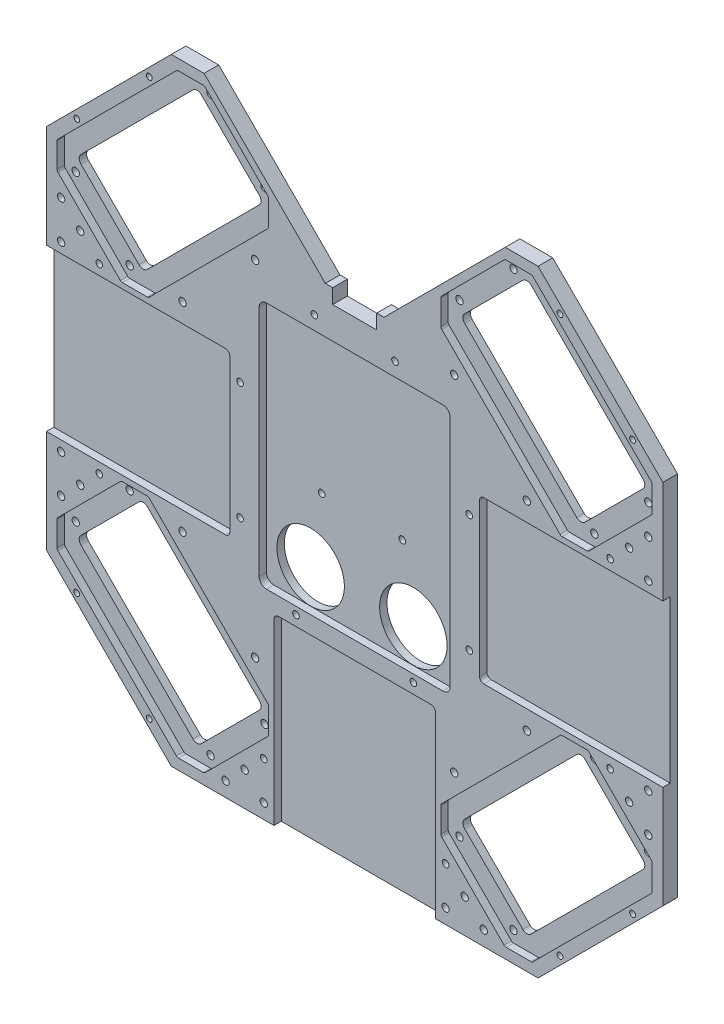
from build123d import *

# Parameters (mm, degrees)
EXTRUDE_1_DEPTH         = 10
CUT_EXTRUDE_16_DEPTH    = 5
CUT_EXTRUDE_13_DEPTH    = 5
SKETCH_7_R              = 23
CUT_EXTRUDE_2_DEPTH     = 298.339778242
SKETCH_12_W             = 30
SKETCH_12_H             = 10
CUT_EXTRUDE_4_DEPTH     = 298.339778242
SKETCH_35_R             = 2.25
CUT_EXTRUDE_8483_DEPTH  = 10
SKETCH_44_W             = 130.264068712
SKETCH_44_H             = 169
CUT_EXTRUDE_17_DEPTH    = 5
FILLET_5_R              = 5
FILLET_6_R              = 2
FILLET_7_R              = 3
FILLET_8_R              = 2
FILLET_9_R              = 2
FILLET_10_R             = 2
FILLET_11_R             = 4
FILLET_12_R             = 4
FILLET_13_R             = 4
FILLET_14_R             = 4
SKETCH_45_R             = 2.5
CUT_EXTRUDE_10446_DEPTH = 298.213633142
SKETCH_46_R             = 2.25
CUT_EXTRUDE_19_DEPTH    = 298.339778242
SKETCH_48_R             = 2.25
CUT_EXTRUDE_11130_DEPTH = 298.339778242
SKETCH_51_R             = 2.5
CUT_EXTRUDE_23_DEPTH    = 298.339778242
SKETCH_57_R             = 2
CUT_EXTRUDE_13307_DEPTH = 10
SKETCH_59_R             = 2.5
CUT_EXTRUDE_13718_DEPTH = 10


# Read off the part's stored shape, not the designer's step: 拉伸1
with BuildPart() as part:
    # 拉伸1 outline → 拉伸1 (new body)
    with BuildSketch(Plane.XY):
        Polygon((210.132034356, 125.036579926), (125.036579926, 210.132034356), (102.651803616, 210.132034356), (20, 127.48023074), (-20, 127.48023074), (-102.651803616, 210.132034356), (-125.036579926, 210.132034356), (-210.132034356, 125.036579926), (-210.132034356, -125.036579926), (-125.036579926, -210.132034356), (125.036579926, -210.132034356), (210.132034356, -125.036579926), align=None)
        Polygon((-194.454364826, -112.429978209), (-149.19953083, -67.175144213), (-67.175144213, -149.19953083), (-112.429978209, -194.454364826), align=None, mode=Mode.SUBTRACT)
        Polygon((149.19953083, -67.175144213), (194.454364826, -112.429978209), (112.429978209, -194.454364826), (67.175144213, -149.19953083), align=None, mode=Mode.SUBTRACT)
        Polygon((-67.175144213, 149.19953083), (-149.19953083, 67.175144213), (-194.454364826, 112.429978209), (-112.429978209, 194.454364826), align=None, mode=Mode.SUBTRACT)
        Polygon((149.19953083, 67.175144213), (67.175144213, 149.19953083), (112.429978209, 194.454364826), (194.454364826, 112.429978209), align=None, mode=Mode.SUBTRACT)
    extrude(amount=EXTRUDE_1_DEPTH)

    # 草图43 → 切除-拉伸16 (cut)
    with BuildSketch(Plane.XY.offset(10)):
        Polygon((-159.159685939, 58.75052301), (-202.878986029, 102.4698231), (-202.878986029, 120.975919755), (-120.975919755, 202.878986029), (-102.4698231, 202.878986029), (-58.75052301, 159.159685939), (-58.75052301, 140.653589284), (-140.653589284, 58.75052301), align=None)
        Polygon((58.75052301, 159.159685939), (58.75052301, 140.653589284), (140.653589284, 58.75052301), (159.159685939, 58.75052301), (202.878986029, 102.4698231), (202.878986029, 120.975919755), (120.975919755, 202.878986029), (102.4698231, 202.878986029), align=None)
        Polygon((-58.75052301, -159.159685939), (-58.75052301, -140.653589284), (-140.653589284, -58.75052301), (-159.159685939, -58.75052301), (-202.878986029, -102.4698231), (-202.878986029, -120.975919755), (-120.975919755, -202.878986029), (-102.4698231, -202.878986029), align=None)
        Polygon((159.159685939, -58.75052301), (202.878986029, -102.4698231), (202.878986029, -120.975919755), (120.975919755, -202.878986029), (102.4698231, -202.878986029), (58.75052301, -159.159685939), (58.75052301, -140.653589284), (140.653589284, -58.75052301), align=None)
    extrude(amount=-CUT_EXTRUDE_16_DEPTH, mode=Mode.SUBTRACT)

    # Sketch 5058 → 切除-拉伸13 (cut)
    with BuildSketch(Plane.XY.offset(10)):
        Polygon((-200.132034356, 55), (-230.171557386, 55), (-230.171557386, -55), (-200.132034356, -55), (-85.132034356, -55), (-85.132034356, 55), align=None)
        Polygon((85.132034356, 55), (201.132034356, 55), (227.171557386, 55), (227.171557386, -55), (200.132034356, -55), (85.132034356, -55), align=None)
        Polygon((55, -85.132034356), (55, -200.132034356), (55, -227.171557386), (-55, -227.171557386), (-55, -200.132034356), (-55, -85.132034356), align=None)
    extrude(amount=-CUT_EXTRUDE_13_DEPTH, mode=Mode.SUBTRACT)

    # 草图7 → 切除-拉伸2 (cut, through all)
    with BuildSketch(Plane.XY.offset(10)):
        with Locations((-35, -50)):
            Circle(SKETCH_7_R)
        with Locations((35, -50)):
            Circle(SKETCH_7_R)
    extrude(amount=-CUT_EXTRUDE_2_DEPTH, mode=Mode.SUBTRACT)

    # 草图12 → 切除-拉伸4 (cut, through all)
    with BuildSketch(Plane.XY.offset(10)):
        with Locations((0, 122.48023074)):
            Rectangle(SKETCH_12_W, SKETCH_12_H)
    extrude(amount=-CUT_EXTRUDE_4_DEPTH, mode=Mode.SUBTRACT)

    # 草图35 → Cut-Extrude 8483 (cut)
    with BuildSketch(Plane(origin=(0, 0, 0), x_dir=(-1, 0, 0), z_dir=(0, 0, -1))):
        with Locations((-27.500339059, 105.296897832)):
            Circle(SKETCH_35_R)
        with Locations((27.499660941, 105.296897832)):
            Circle(SKETCH_35_R)
        with Locations((-27.500339059, -2.703102168)):
            Circle(SKETCH_35_R)
        with Locations((27.499660941, -2.703102168)):
            Circle(SKETCH_35_R)
    extrude(amount=-CUT_EXTRUDE_8483_DEPTH, mode=Mode.SUBTRACT)

    # 草图44 → 切除-拉伸17 (cut)
    with BuildSketch(Plane.XY.offset(10)):
        with Locations((0, 11.367965644)):
            Rectangle(SKETCH_44_W, SKETCH_44_H)
    extrude(amount=-CUT_EXTRUDE_17_DEPTH, mode=Mode.SUBTRACT)

    # 圆角5
    fillet_5_edges = [part.edges().sort_by_distance(p)[0] for p in [
        (-65.132034356, -73.132034356, 7.5),
        (-65.132034356, 95.867965644, 7.5),
        (65.132034356, 95.867965644, 7.5),
        (65.132034356, -73.132034356, 7.5),
    ]]
    fillet(fillet_5_edges, radius=FILLET_5_R)

    # 圆角6
    fillet_6_edges = [part.edges().sort_by_distance(p)[0] for p in [
        (-202.878986029, 102.4698231, 7.5),
        (-202.878986029, 120.975919755, 7.5),
        (-120.975919755, 202.878986029, 7.5),
        (-102.4698231, 202.878986029, 7.5),
        (-58.75052301, 159.159685939, 7.5),
        (-58.75052301, 140.653589284, 7.5),
        (-140.653589284, 58.75052301, 7.5),
        (-159.159685939, 58.75052301, 7.5),
    ]]
    fillet(fillet_6_edges, radius=FILLET_6_R)

    # 圆角7
    fillet_7_edges = [part.edges().sort_by_distance(p)[0] for p in [
        (-85.132034356, -55, 7.5),
        (-85.132034356, 55, 7.5),
        (85.132034356, -55, 7.5),
        (85.132034356, 55, 7.5),
        (55, -85.132034356, 7.5),
        (-55, -85.132034356, 7.5),
    ]]
    fillet(fillet_7_edges, radius=FILLET_7_R)

    # 圆角8
    fillet_8_edges = [part.edges().sort_by_distance(p)[0] for p in [
        (58.75052301, 159.159685939, 7.5),
        (102.4698231, 202.878986029, 7.5),
        (120.975919755, 202.878986029, 7.5),
        (202.878986029, 120.975919755, 7.5),
        (202.878986029, 102.4698231, 7.5),
        (159.159685939, 58.75052301, 7.5),
        (140.653589284, 58.75052301, 7.5),
        (58.75052301, 140.653589284, 7.5),
    ]]
    fillet(fillet_8_edges, radius=FILLET_8_R)

    # 圆角9
    fillet_9_edges = [part.edges().sort_by_distance(p)[0] for p in [
        (140.653589284, -58.75052301, 7.5),
        (159.159685939, -58.75052301, 7.5),
        (202.878986029, -102.4698231, 7.5),
        (202.878986029, -120.975919755, 7.5),
        (120.975919755, -202.878986029, 7.5),
        (102.4698231, -202.878986029, 7.5),
        (58.75052301, -159.159685939, 7.5),
        (58.75052301, -140.653589284, 7.5),
    ]]
    fillet(fillet_9_edges, radius=FILLET_9_R)

    # 圆角10
    fillet_10_edges = [part.edges().sort_by_distance(p)[0] for p in [
        (-58.75052301, -159.159685939, 7.5),
        (-102.4698231, -202.878986029, 7.5),
        (-120.975919755, -202.878986029, 7.5),
        (-202.878986029, -120.975919755, 7.5),
        (-202.878986029, -102.4698231, 7.5),
        (-159.159685939, -58.75052301, 7.5),
        (-140.653589284, -58.75052301, 7.5),
        (-58.75052301, -140.653589284, 7.5),
    ]]
    fillet(fillet_10_edges, radius=FILLET_10_R)

    # 圆角11
    fillet_11_edges = [part.edges().sort_by_distance(p)[0] for p in [
        (194.454364826, -112.429978209, 2.5),
        (149.19953083, -67.175144213, 2.5),
        (67.175144213, -149.19953083, 2.5),
        (112.429978209, -194.454364826, 2.5),
    ]]
    fillet(fillet_11_edges, radius=FILLET_11_R)

    # 圆角12
    fillet_12_edges = [part.edges().sort_by_distance(p)[0] for p in [
        (-194.454364826, -112.429978209, 2.5),
        (-112.429978209, -194.454364826, 2.5),
        (-67.175144213, -149.19953083, 2.5),
        (-149.19953083, -67.175144213, 2.5),
    ]]
    fillet(fillet_12_edges, radius=FILLET_12_R)

    # 圆角13
    fillet_13_edges = [part.edges().sort_by_distance(p)[0] for p in [
        (-67.175144213, 149.19953083, 2.5),
        (-112.429978209, 194.454364826, 2.5),
        (-194.454364826, 112.429978209, 2.5),
        (-149.19953083, 67.175144213, 2.5),
    ]]
    fillet(fillet_13_edges, radius=FILLET_13_R)

    # 圆角14
    fillet_14_edges = [part.edges().sort_by_distance(p)[0] for p in [
        (149.19953083, 67.175144213, 2.5),
        (194.454364826, 112.429978209, 2.5),
        (112.429978209, 194.454364826, 2.5),
        (67.175144213, 149.19953083, 2.5),
    ]]
    fillet(fillet_14_edges, radius=FILLET_14_R)

    # 草图45 → Cut-Extrude 10446 (cut, through all)
    with BuildSketch(Plane.XY.offset(5)):
        with Locations((-195.161471607, 103.237590053)):
            Circle(SKETCH_45_R)
        with Locations((-158.391918986, 66.468037432)):
            Circle(SKETCH_45_R)
        with Locations((-103.237590053, 195.161471607)):
            Circle(SKETCH_45_R)
        with Locations((-66.468037432, 158.391918986)):
            Circle(SKETCH_45_R)
        with Locations(Location((66.468037432, 158.391918986, 0), (0, 0, 180))):
            Circle(SKETCH_45_R)
        with Locations(Location((103.237590053, 195.161471607, 0), (0, 0, 180))):
            Circle(SKETCH_45_R)
        with Locations(Location((158.391918986, 66.468037432, 0), (0, 0, 180))):
            Circle(SKETCH_45_R)
        with Locations(Location((195.161471607, 103.237590053, 0), (0, 0, 180))):
            Circle(SKETCH_45_R)
        with Locations((195.161471607, -103.237590053)):
            Circle(SKETCH_45_R)
        with Locations((158.391918986, -66.468037432)):
            Circle(SKETCH_45_R)
        with Locations((103.237590053, -195.161471607)):
            Circle(SKETCH_45_R)
        with Locations((66.468037432, -158.391918986)):
            Circle(SKETCH_45_R)
        with Locations(Location((-66.468037432, -158.391918986, 0), (0, 0, 180))):
            Circle(SKETCH_45_R)
        with Locations(Location((-103.237590053, -195.161471607, 0), (0, 0, 180))):
            Circle(SKETCH_45_R)
        with Locations(Location((-158.391918986, -66.468037432, 0), (0, 0, 180))):
            Circle(SKETCH_45_R)
        with Locations(Location((-195.161471607, -103.237590053, 0), (0, 0, 180))):
            Circle(SKETCH_45_R)
    extrude(amount=-CUT_EXTRUDE_10446_DEPTH, mode=Mode.SUBTRACT)

    # 草图46 → 切除-拉伸19 (cut, through all)
    with BuildSketch(Plane.XY.offset(10)):
        with Locations((-40, -78.132034356)):
            Circle(SKETCH_46_R)
        with Locations((40, -78.132034356)):
            Circle(SKETCH_46_R)
        with Locations((-78.132034356, 40)):
            Circle(SKETCH_46_R)
        with Locations((-78.132034356, -40)):
            Circle(SKETCH_46_R)
        with Locations((78.132034356, -40)):
            Circle(SKETCH_46_R)
        with Locations((78.132034356, 40)):
            Circle(SKETCH_46_R)
    extrude(amount=-CUT_EXTRUDE_19_DEPTH, mode=Mode.SUBTRACT)

    # 草图48 → Cut-Extrude 11130 (cut, through all)
    with BuildSketch(Plane.XY.offset(10)):
        with Locations((-174.132034356, 62)):
            Circle(SKETCH_48_R)
        with Locations((-174.132034356, -62)):
            Circle(SKETCH_48_R)
        with Locations((174.132034356, -62)):
            Circle(SKETCH_48_R)
        with Locations((174.132034356, 62)):
            Circle(SKETCH_48_R)
        with Locations((-62, -174.132034356)):
            Circle(SKETCH_48_R)
        with Locations((62, -174.132034356)):
            Circle(SKETCH_48_R)
    extrude(amount=-CUT_EXTRUDE_11130_DEPTH, mode=Mode.SUBTRACT)

    # 草图51 → 切除-拉伸23 (cut, through all)
    with BuildSketch(Plane.XY.offset(10)):
        with Locations((-200.132034356, 88)):
            Circle(SKETCH_51_R)
        with Locations((-187.132034356, 75)):
            Circle(SKETCH_51_R)
        with Locations((-200.132034356, 62)):
            Circle(SKETCH_51_R)
        with Locations((-187.132034356, -75)):
            Circle(SKETCH_51_R)
        with Locations((-200.132034356, -62)):
            Circle(SKETCH_51_R)
        with Locations((-200.132034356, -88)):
            Circle(SKETCH_51_R)
        with Locations((200.132034356, -62)):
            Circle(SKETCH_51_R)
        with Locations((200.132034356, -88)):
            Circle(SKETCH_51_R)
        with Locations((200.132034356, 62)):
            Circle(SKETCH_51_R)
        with Locations((200.132034356, 88)):
            Circle(SKETCH_51_R)
        with Locations((187.132034356, -75)):
            Circle(SKETCH_51_R)
        with Locations((187.132034356, 75)):
            Circle(SKETCH_51_R)
        with Locations((-62, -200.132034356)):
            Circle(SKETCH_51_R)
        with Locations((-88, -200.132034356)):
            Circle(SKETCH_51_R)
        with Locations((62, -200.132034356)):
            Circle(SKETCH_51_R)
        with Locations((88, -200.132034356)):
            Circle(SKETCH_51_R)
        with Locations((-75, -187.132034356)):
            Circle(SKETCH_51_R)
        with Locations((75, -187.132034356)):
            Circle(SKETCH_51_R)
    extrude(amount=-CUT_EXTRUDE_23_DEPTH, mode=Mode.SUBTRACT)

    # 草图57 → Cut-Extrude 13307 (cut)
    with BuildSketch(Plane.XY.offset(10)):
        with Locations((-189.504617358, 140.007142675)):
            Circle(SKETCH_57_R)
        with Locations((-140.007142675, 189.504617358)):
            Circle(SKETCH_57_R)
        with Locations((189.504617358, 140.007142675)):
            Circle(SKETCH_57_R)
        with Locations((140.007142675, 189.504617358)):
            Circle(SKETCH_57_R)
        with Locations((140.007142675, -189.504617358)):
            Circle(SKETCH_57_R)
        with Locations((189.504617358, -140.007142675)):
            Circle(SKETCH_57_R)
        with Locations((-189.504617358, -140.007142675)):
            Circle(SKETCH_57_R)
        with Locations((-140.007142675, -189.504617358)):
            Circle(SKETCH_57_R)
    extrude(amount=-CUT_EXTRUDE_13307_DEPTH, mode=Mode.SUBTRACT)

    # 草图59 → Cut-Extrude 13718 (cut)
    with BuildSketch(Plane.XY.offset(10)):
        with Locations((-67.882250994, 117.379725677)):
            Circle(SKETCH_59_R)
        with Locations((-117.379725677, 67.882250994)):
            Circle(SKETCH_59_R)
        with Locations((67.882250994, 117.379725677)):
            Circle(SKETCH_59_R)
        with Locations((117.379725677, 67.882250994)):
            Circle(SKETCH_59_R)
        with Locations((117.379725677, -67.882250994)):
            Circle(SKETCH_59_R)
        with Locations((67.882250994, -117.379725677)):
            Circle(SKETCH_59_R)
        with Locations((-67.882250994, -117.379725677)):
            Circle(SKETCH_59_R)
        with Locations((-117.379725677, -67.882250994)):
            Circle(SKETCH_59_R)
    extrude(amount=-CUT_EXTRUDE_13718_DEPTH, mode=Mode.SUBTRACT)


solid = part.part
